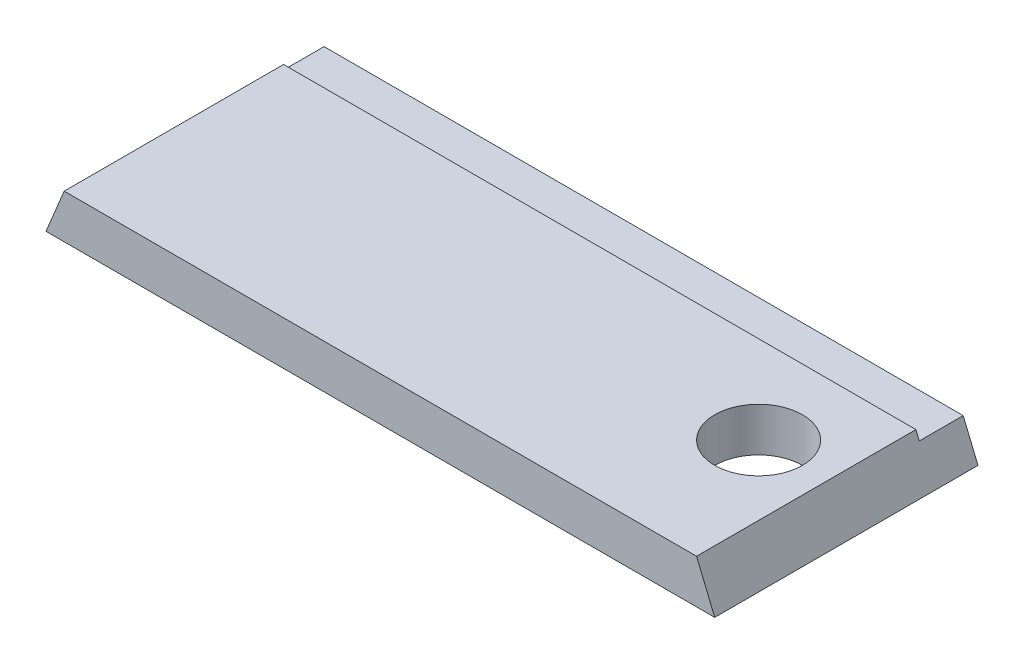
from build123d import *

# Parameters (mm, degrees)
BOSS_EXTRUDE1_DEPTH = 76.2
SKETCH2_W           = 193.548
SKETCH2_H           = 12.7
CUT_EXTRUDE1_DEPTH  = 2.3622
SKETCH3_R           = 12.7
CUT_EXTRUDE2_DEPTH  = 209.395197411


with BuildPart() as part:
    # Sketch1 → Boss-Extrude1 (new body)
    with BuildSketch(Plane.XY):
        Polygon((0, 0), (193.548, 0), (188.287487758, 12.7), (5.260512242, 12.7), align=None)
    extrude(amount=BOSS_EXTRUDE1_DEPTH)

    # Sketch2 → Cut-Extrude1 (cut)
    with BuildSketch(Plane(origin=(0, 12.7, 0), x_dir=(1, 0, 0), z_dir=(0, 1, 0))):
        with Locations((96.774, -6.35)):
            Rectangle(SKETCH2_W, SKETCH2_H)
    extrude(amount=-CUT_EXTRUDE1_DEPTH, mode=Mode.SUBTRACT)

    # Sketch3 → Cut-Extrude2 (cut, through all)
    with BuildSketch(Plane.XZ):
        with Locations((168.148, 38.1)):
            Circle(SKETCH3_R)
    extrude(amount=-CUT_EXTRUDE2_DEPTH, mode=Mode.SUBTRACT)


solid = part.part
